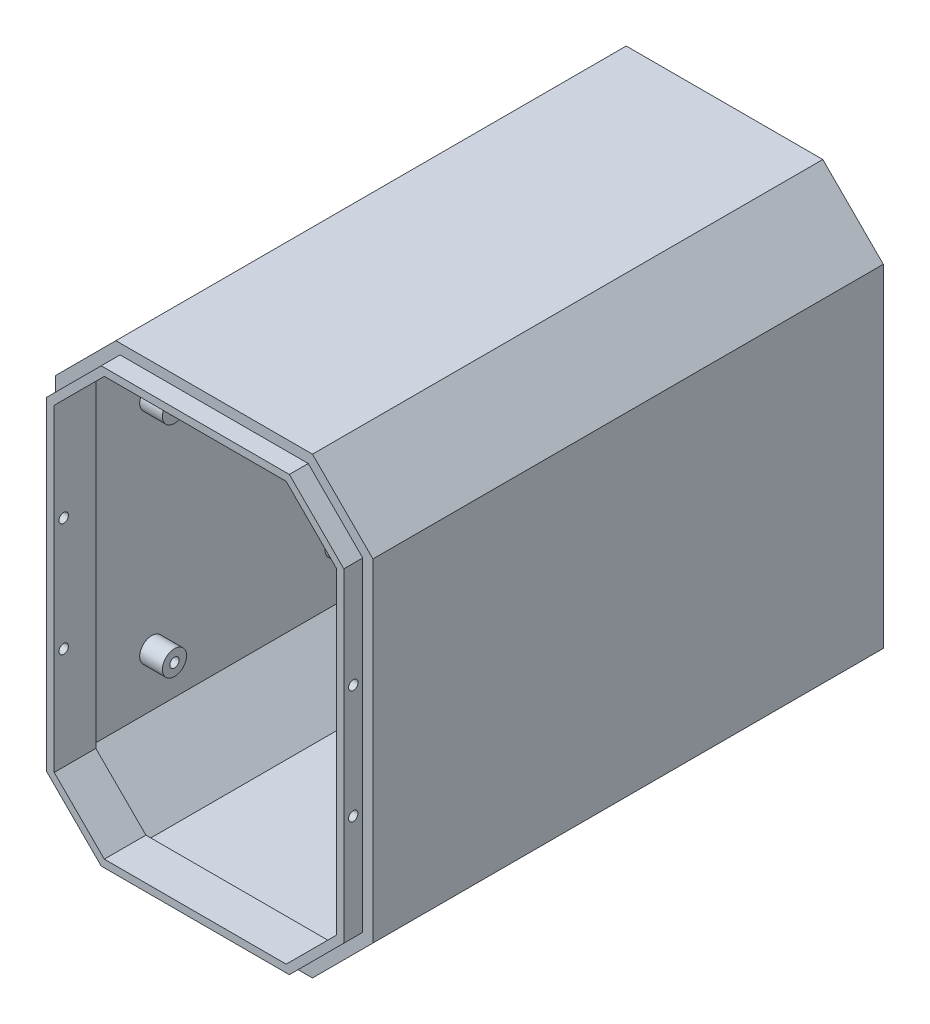
from build123d import *

# Parameters (mm, degrees)
BOSS_1_DEPTH   = 135
CUT_2_DEPTH    = 96.975
CUT_3_DEPTH    = 35.725
S_CUT4_W       = 8
S_CUT4_H       = 28
POCKET_4_DEPTH = 2.7
S_HOLE5_R      = 6
HOLE_5_DEPTH   = 2.7
S_HOLE6_R      = 1.6
HOLE_6_DEPTH   = 2.7
S_HOLE7_R      = 1.6
HOLE_7_DEPTH   = 2.7
S_HOLE8_R      = 1.6
HOLE_8_DEPTH   = 2.7
S_HOLE9_R      = 1.6
HOLE_9_DEPTH   = 2.7
BOSS_10_DEPTH  = 6
BOSS_11_DEPTH  = 5.1
S_CYL12_R      = 3.2
BOSS_12_DEPTH  = 6.5
S_CYL13_R      = 3.2
BOSS_13_DEPTH  = 6.5
S_CYL14_R      = 3.2
BOSS_14_DEPTH  = 6.5
S_CYL15_R      = 3.2
BOSS_15_DEPTH  = 6.5
CUT_16_DEPTH   = 11.2
S_HOLE17_R     = 1.25
HOLE_17_DEPTH  = 2.7
S_HOLE18_R     = 1.25
HOLE_18_DEPTH  = 2.7
S_HOLE19_R     = 1.25
HOLE_19_DEPTH  = 2.7
S_HOLE20_R     = 1.25
HOLE_20_DEPTH  = 2.7
S_HOLE21_R     = 1.25
HOLE_21_DEPTH  = 6.1
S_HOLE22_R     = 1.25
HOLE_22_DEPTH  = 6.1
S_HOLE23_R     = 1.25
HOLE_23_DEPTH  = 6.1
S_HOLE24_R     = 1.25
HOLE_24_DEPTH  = 6.1


with BuildPart() as part:
    # S_prism1 → Boss_1 (new body)
    with BuildSketch(Plane.XY.offset(33)):
        Polygon((42, -44), (42, 44), (26, 60), (-26, 60), (-42, 44), (-42, -44), (-26, -60), (26, -60), align=None)
    extrude(amount=BOSS_1_DEPTH)

    # S_pcut2 → Cut_2 (cut)
    with BuildSketch(Plane.XY.offset(71.125)):
        Polygon((39.5, -42.964466094), (39.5, 42.964466094), (24.964466094, 57.5), (-24.964466094, 57.5), (-39.5, 42.964466094), (-39.5, -42.964466094), (-24.964466094, -57.5), (24.964466094, -57.5), align=None)
    extrude(amount=CUT_2_DEPTH, mode=Mode.SUBTRACT)

    # S_pcut3 → Cut_3 (cut)
    with BuildSketch(Plane.XY.offset(32.9)):
        Polygon((39.5, -42.964466094), (39.5, 42.964466094), (24.964466094, 57.5), (-24.964466094, 57.5), (-39.5, 42.964466094), (-39.5, -42.964466094), (-24.964466094, -57.5), (24.964466094, -57.5), align=None)
    extrude(amount=CUT_3_DEPTH, mode=Mode.SUBTRACT)

    # S_cut4 → Pocket_4 (cut)
    with BuildSketch(Plane.XY.offset(68.525)):
        with Locations((-30, 0)):
            Rectangle(S_CUT4_W, S_CUT4_H)
    extrude(amount=POCKET_4_DEPTH, mode=Mode.SUBTRACT)

    # S_hole5 → Hole_5 (cut)
    with BuildSketch(Plane(origin=(-42.1, 0, 0), x_dir=(0, 0, -1), z_dir=(1, 0, 0))):
        with Locations((-88, 0)):
            Circle(S_HOLE5_R)
    extrude(amount=HOLE_5_DEPTH, mode=Mode.SUBTRACT)

    # S_hole6 → Hole_6 (cut)
    with BuildSketch(Plane.XY.offset(68.525)):
        with Locations((-20, -25)):
            Circle(S_HOLE6_R)
    extrude(amount=HOLE_6_DEPTH, mode=Mode.SUBTRACT)

    # S_hole7 → Hole_7 (cut)
    with BuildSketch(Plane.XY.offset(68.525)):
        with Locations((-20, 25)):
            Circle(S_HOLE7_R)
    extrude(amount=HOLE_7_DEPTH, mode=Mode.SUBTRACT)

    # S_hole8 → Hole_8 (cut)
    with BuildSketch(Plane.XY.offset(68.525)):
        with Locations((24, -25)):
            Circle(S_HOLE8_R)
    extrude(amount=HOLE_8_DEPTH, mode=Mode.SUBTRACT)

    # S_hole9 → Hole_9 (cut)
    with BuildSketch(Plane.XY.offset(68.525)):
        with Locations((24, 25)):
            Circle(S_HOLE9_R)
    extrude(amount=HOLE_9_DEPTH, mode=Mode.SUBTRACT)

    # S_prism10 → Boss_10 (add)
    with BuildSketch(Plane.XY.offset(162)):
        Polygon((40, -43.171572875), (40, 43.171572875), (25.171572875, 58), (-25.171572875, 58), (-40, 43.171572875), (-40, -43.171572875), (-25.171572875, -58), (25.171572875, -58), align=None)
    extrude(amount=BOSS_10_DEPTH)

    # S_prism11 → Boss_11 (add)
    with BuildSketch(Plane.XY.offset(167.9)):
        Polygon((39.3, -42.881623382), (39.3, 42.881623382), (24.881623382, 57.3), (-24.881623382, 57.3), (-39.3, 42.881623382), (-39.3, -42.881623382), (-24.881623382, -57.3), (24.881623382, -57.3), align=None)
    extrude(amount=BOSS_11_DEPTH)

    # S_cyl12 → Boss_12 (add)
    with BuildSketch(Plane(origin=(-40, 0, 0), x_dir=(0, 0, -1), z_dir=(1, 0, 0))):
        with Locations((-96, -29)):
            Circle(S_CYL12_R)
    extrude(amount=BOSS_12_DEPTH)

    # S_cyl13 → Boss_13 (add)
    with BuildSketch(Plane(origin=(-40, 0, 0), x_dir=(0, 0, -1), z_dir=(1, 0, 0))):
        with Locations((-145, -29)):
            Circle(S_CYL13_R)
    extrude(amount=BOSS_13_DEPTH)

    # S_cyl14 → Boss_14 (add)
    with BuildSketch(Plane(origin=(-40, 0, 0), x_dir=(0, 0, -1), z_dir=(1, 0, 0))):
        with Locations((-96, 29)):
            Circle(S_CYL14_R)
    extrude(amount=BOSS_14_DEPTH)

    # S_cyl15 → Boss_15 (add)
    with BuildSketch(Plane(origin=(-40, 0, 0), x_dir=(0, 0, -1), z_dir=(1, 0, 0))):
        with Locations((-145, 29)):
            Circle(S_CYL15_R)
    extrude(amount=BOSS_15_DEPTH)

    # S_pcut16 → Cut_16 (cut)
    with BuildSketch(Plane.XY.offset(161.9)):
        Polygon((37.3, -42.053196257), (37.3, 42.053196257), (24.053196257, 55.3), (-24.053196257, 55.3), (-37.3, 42.053196257), (-37.3, -42.053196257), (-24.053196257, -55.3), (24.053196257, -55.3), align=None)
    extrude(amount=CUT_16_DEPTH, mode=Mode.SUBTRACT)

    # S_hole17 → Hole_17 (cut)
    with BuildSketch(Plane(origin=(37.1, 0, 0), x_dir=(0, 0, -1), z_dir=(1, 0, 0))):
        with Locations((-170.5, -15)):
            Circle(S_HOLE17_R)
    extrude(amount=HOLE_17_DEPTH, mode=Mode.SUBTRACT)

    # S_hole18 → Hole_18 (cut)
    with BuildSketch(Plane(origin=(37.1, 0, 0), x_dir=(0, 0, -1), z_dir=(1, 0, 0))):
        with Locations((-170.5, 15)):
            Circle(S_HOLE18_R)
    extrude(amount=HOLE_18_DEPTH, mode=Mode.SUBTRACT)

    # S_hole19 → Hole_19 (cut)
    with BuildSketch(Plane(origin=(-39.8, 0, 0), x_dir=(0, 0, -1), z_dir=(1, 0, 0))):
        with Locations((-170.5, -15)):
            Circle(S_HOLE19_R)
    extrude(amount=HOLE_19_DEPTH, mode=Mode.SUBTRACT)

    # S_hole20 → Hole_20 (cut)
    with BuildSketch(Plane(origin=(-39.8, 0, 0), x_dir=(0, 0, -1), z_dir=(1, 0, 0))):
        with Locations((-170.5, 15)):
            Circle(S_HOLE20_R)
    extrude(amount=HOLE_20_DEPTH, mode=Mode.SUBTRACT)

    # S_hole21 → Hole_21 (cut)
    with BuildSketch(Plane(origin=(-39.5, 0, 0), x_dir=(0, 0, -1), z_dir=(1, 0, 0))):
        with Locations((-96, -29)):
            Circle(S_HOLE21_R)
    extrude(amount=HOLE_21_DEPTH, mode=Mode.SUBTRACT)

    # S_hole22 → Hole_22 (cut)
    with BuildSketch(Plane(origin=(-39.5, 0, 0), x_dir=(0, 0, -1), z_dir=(1, 0, 0))):
        with Locations((-145, -29)):
            Circle(S_HOLE22_R)
    extrude(amount=HOLE_22_DEPTH, mode=Mode.SUBTRACT)

    # S_hole23 → Hole_23 (cut)
    with BuildSketch(Plane(origin=(-39.5, 0, 0), x_dir=(0, 0, -1), z_dir=(1, 0, 0))):
        with Locations((-96, 29)):
            Circle(S_HOLE23_R)
    extrude(amount=HOLE_23_DEPTH, mode=Mode.SUBTRACT)

    # S_hole24 → Hole_24 (cut)
    with BuildSketch(Plane(origin=(-39.5, 0, 0), x_dir=(0, 0, -1), z_dir=(1, 0, 0))):
        with Locations((-145, 29)):
            Circle(S_HOLE24_R)
    extrude(amount=HOLE_24_DEPTH, mode=Mode.SUBTRACT)


solid = part.part
